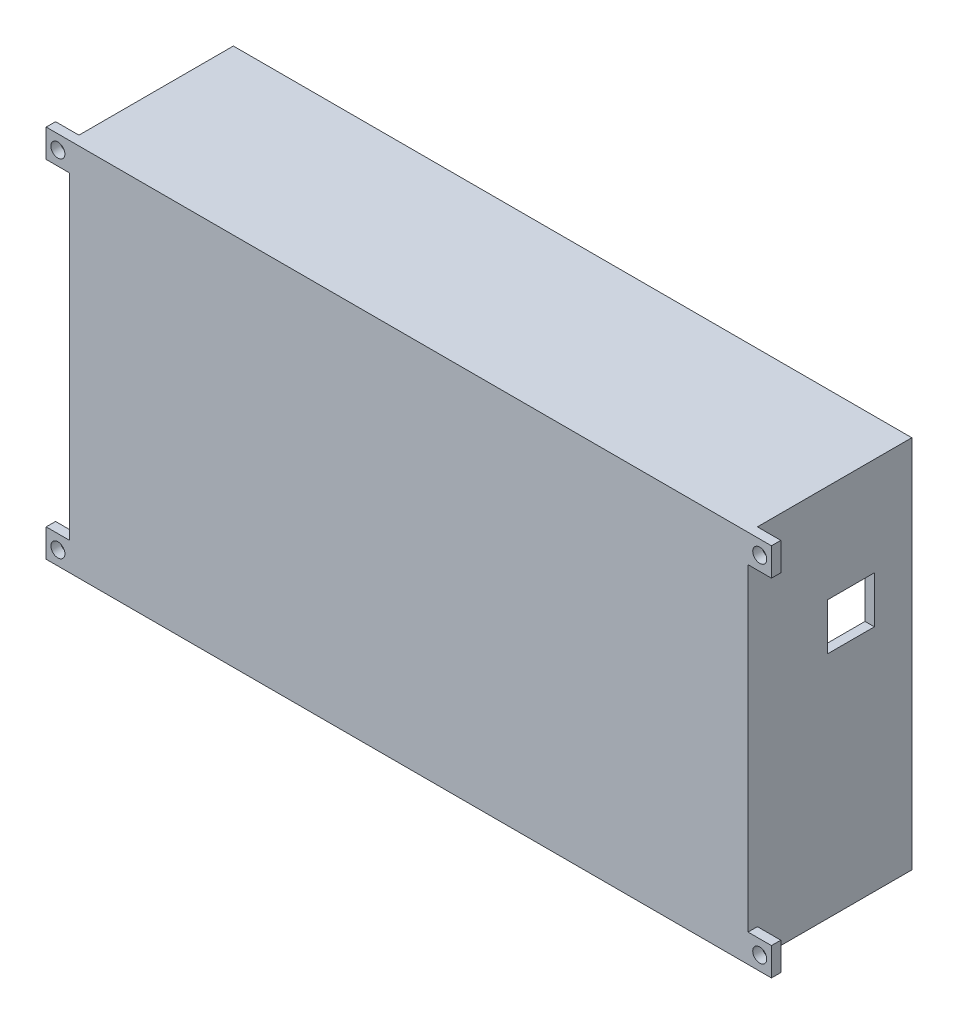
from build123d import *

# Parameters (mm, degrees)
SKETCH_1_W                       = 145
SKETCH_1_H                       = 80
EXTRUDE_1_DEPTH                  = 35
SKETCH_2_W                       = 141
SKETCH_2_H                       = 76
CUT_EXTRUDE_1_DEPTH              = 33
SKETCH_3_R                       = 3.5
EXTRUDE_2_DEPTH                  = 15
SKETCH_4_R                       = 1.5
CUT_EXTRUDE_2_DEPTH              = 15
SKETCH_5_W                       = 10
SKETCH_5_H                       = 10
SKETCH_5_W_2                     = 16
SKETCH_5_H_2                     = 21
CUT_EXTRUDE_3_DEPTH              = 15
SKETCH_6_W                       = 10
SKETCH_6_H                       = 10
CUT_EXTRUDE_4_DEPTH              = 15
SKETCH_9_R                       = 3.5
EXTRUDE_3_DEPTH                  = 33
SKETCH_10_R                      = 1.5
CUT_EXTRUDE_5_DEPTH              = 33
PATTERN_LINEAR_2_COUNT           = 2
PATTERN_LINEAR_2_PITCH           = 72
PATTERN_LINEAR_2_COUNT_DIR2      = 2
PATTERN_LINEAR_2_PITCH_DIR2      = 137
SKETCH_12_W                      = 2
SKETCH_12_H                      = 6
EXTRUDE_4_DEPTH                  = 5
SKETCH_13_R                      = 1.5
CUT_EXTRUDE_6_DEPTH              = 5
PATTERN_LINEAR_3_COUNT           = 2
PATTERN_LINEAR_3_PITCH           = 74
PATTERN_LINEAR_4_COUNT           = 2
PATTERN_LINEAR_4_PITCH           = 150
PATTERN_LINEAR_4_COPY_1_SKETCH_R = 1.5
PATTERN_LINEAR_4_COPY_1_DEPTH    = 5
PATTERN_LINEAR_4_COPY_2_SKETCH_R = 1.5
PATTERN_LINEAR_4_COPY_2_DEPTH    = 5


with BuildPart() as part:
    # Эскиз1 → Бобышка-Вытянуть1 (new body)
    with BuildSketch(Plane.XY):
        with Locations((72.5, 40)):
            Rectangle(SKETCH_1_W, SKETCH_1_H)
    extrude(amount=EXTRUDE_1_DEPTH)

    # Эскиз2 → Вырез-Вытянуть1 (cut)
    with BuildSketch(Plane(origin=(0, 0, 0), x_dir=(-1, 0, 0), z_dir=(0, 0, -1))):
        with Locations((-72.5, 40)):
            Rectangle(SKETCH_2_W, SKETCH_2_H)
    extrude(amount=-CUT_EXTRUDE_1_DEPTH, mode=Mode.SUBTRACT)

    # Эскиз3 → Бобышка-Вытянуть2 (add)
    with BuildSketch(Plane(origin=(0, 0, 33), x_dir=(-1, 0, 0), z_dir=(0, 0, -1))):
        with Locations((-109.79, 62.86)):
            Circle(SKETCH_3_R)
        with Locations((-109.79, 17.14)):
            Circle(SKETCH_3_R)
        with Locations((-34.79, 64.13)):
            Circle(SKETCH_3_R)
        with Locations((-34.79, 15.87)):
            Circle(SKETCH_3_R)
    extrude(amount=EXTRUDE_2_DEPTH)

    # Эскиз4 → Вырез-Вытянуть2 (cut)
    with BuildSketch(Plane(origin=(0, 0, 18), x_dir=(-1, 0, 0), z_dir=(0, 0, -1))):
        with Locations((-109.79, 62.86)):
            Circle(SKETCH_4_R)
        with Locations((-34.79, 64.13)):
            Circle(SKETCH_4_R)
        with Locations((-34.79, 15.87)):
            Circle(SKETCH_4_R)
        with Locations((-109.79, 17.14)):
            Circle(SKETCH_4_R)
    extrude(amount=-CUT_EXTRUDE_2_DEPTH, mode=Mode.SUBTRACT)

    # Эскиз5 → Вырез-Вытянуть3 (cut)
    with BuildSketch(Plane.ZY):
        with Locations((13, 26)):
            Rectangle(SKETCH_5_W, SKETCH_5_H)
        with Locations((14, 51.5)):
            Rectangle(SKETCH_5_W_2, SKETCH_5_H_2)
    extrude(amount=-CUT_EXTRUDE_3_DEPTH, mode=Mode.SUBTRACT)

    # Эскиз6 → Вырез-Вытянуть4 (cut)
    with BuildSketch(Plane.ZY.offset(-143)):
        with Locations((13, 54)):
            Rectangle(SKETCH_6_W, SKETCH_6_H)
    extrude(amount=-CUT_EXTRUDE_4_DEPTH, mode=Mode.SUBTRACT)

    # Эскиз9 → Бобышка-Вытянуть3 (add)
    with BuildSketch(Plane(origin=(0, 0, 33), x_dir=(-1, 0, 0), z_dir=(0, 0, -1))):
        with Locations((-4, 76)):
            Circle(SKETCH_9_R)
    extrude_3 = extrude(amount=EXTRUDE_3_DEPTH)

    # Эскиз10 → Вырез-Вытянуть5 (cut)
    with BuildSketch(Plane(origin=(0, 0, 0), x_dir=(-1, 0, 0), z_dir=(0, 0, -1))):
        with Locations((-4, 76)):
            Circle(SKETCH_10_R)
    cut_extrude_5 = extrude(amount=-CUT_EXTRUDE_5_DEPTH, mode=Mode.SUBTRACT)

    # Линейный массив2: Бобышка-Вытянуть3, Cut-Extrude 5 2 × 2
    with Locations(*[(j * PATTERN_LINEAR_2_PITCH_DIR2, -i * PATTERN_LINEAR_2_PITCH, 0) for i in range(PATTERN_LINEAR_2_COUNT) for j in range(PATTERN_LINEAR_2_COUNT_DIR2) if (i, j) != (0, 0)]):
        add(extrude_3)
        add(cut_extrude_5, mode=Mode.SUBTRACT)

    # Эскиз12 → Бобышка-Вытянуть4 (add)
    with BuildSketch(Plane(origin=(145, 0, 0), x_dir=(0, 0, -1), z_dir=(1, 0, 0))):
        with Locations((-34, 77)):
            Rectangle(SKETCH_12_W, SKETCH_12_H)
        with Locations((-34, 3)):
            Rectangle(SKETCH_12_W, SKETCH_12_H)
    extrude_4 = extrude(amount=EXTRUDE_4_DEPTH)

    # Эскиз13 → Вырез-Вытянуть6 (cut)
    with BuildSketch(Plane(origin=(0, 0, 33), x_dir=(-1, 0, 0), z_dir=(0, 0, -1))):
        with Locations((-147.5, 77)):
            Circle(SKETCH_13_R)
    cut_extrude_6 = extrude(amount=-CUT_EXTRUDE_6_DEPTH, mode=Mode.SUBTRACT)

    # Линейный массив3: Вырез-Вытянуть6 ×2
    with Locations(*[(0, -i * PATTERN_LINEAR_3_PITCH, 0) for i in range(1, PATTERN_LINEAR_3_COUNT)]):
        add(cut_extrude_6, mode=Mode.SUBTRACT)

    # Линейный массив4: Бобышка-Вытянуть4 ×2
    with Locations(*[(-i * PATTERN_LINEAR_4_PITCH, 0, 0) for i in range(1, PATTERN_LINEAR_4_COUNT)]):
        add(extrude_4)

    # Линейный массив4 copy 1 sketch → Линейный массив4 copy 1 (cut)
    with BuildSketch(Plane(origin=(-150, -74, 33), x_dir=(-1, 0, 0), z_dir=(0, 0, -1))):
        with Locations((-147.5, 77)):
            Circle(PATTERN_LINEAR_4_COPY_1_SKETCH_R)
    extrude(amount=-PATTERN_LINEAR_4_COPY_1_DEPTH, mode=Mode.SUBTRACT)

    # Линейный массив4 copy 2 sketch → Линейный массив4 copy 2 (cut)
    with BuildSketch(Plane(origin=(-150, 0, 33), x_dir=(-1, 0, 0), z_dir=(0, 0, -1))):
        with Locations((-147.5, 77)):
            Circle(PATTERN_LINEAR_4_COPY_2_SKETCH_R)
    extrude(amount=-PATTERN_LINEAR_4_COPY_2_DEPTH, mode=Mode.SUBTRACT)


solid = part.part
